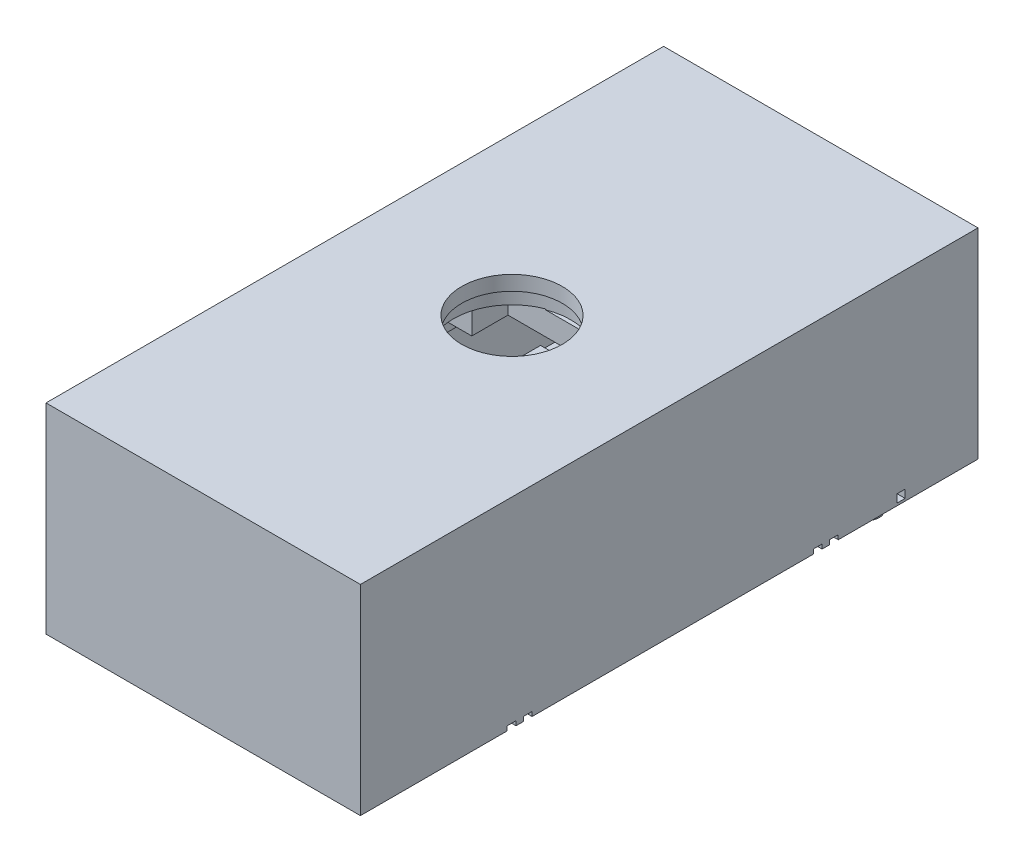
from build123d import *

# Parameters (mm, degrees)
BLOCK_START                       = 4.7
SKETCH1_W                         = 39.1
SKETCH1_H                         = 76.8
BLOCK_DEPTH                       = 24.90232
CELL_START                        = 7.14
SKETCH2_W                         = 34.9
SKETCH2_H                         = 53.5
CELL_POCKET_DEPTH                 = 11.86
CELL_START_2                      = 6.6
SKETCH3_W                         = 34.9
SKETCH3_H                         = 10.6
CELL_PROTECTION_BOARD_END_DEPTH   = 0.54
S1_S3_START                       = 4.7
SKETCH4_W                         = 9.25
SKETCH4_H                         = 6.5
SKETCH4_W_2                       = 9.05
S1_S3_AND_PLUG_POCKETS_DEPTH      = 1.9
J4_START                          = 4.7
SKETCH5_W                         = 17.5
SKETCH5_H                         = 10.7
J4_AND_FLEX_ENTRY_DEPTH           = 1.9
SKETCH6_W                         = 17.5
SKETCH6_H                         = 4.8
J4_FLEX_RISER_DEPTH               = 20.19
FLEX_START                        = 19
SKETCH7_W                         = 17.5
SKETCH7_H                         = 20.9
FLEX_CHANNEL_OVER_THE_CELLS_DEPTH = 5.89
CAMERA_START                      = 19
SKETCH8_W                         = 25.6
SKETCH8_H                         = 24.5
CAMERA_BOARD_POCKET_DEPTH         = 3.58232
HOLDER_START                      = 22.48232
SKETCH9_W                         = 14.6
SKETCH9_H                         = 13.6
HOLDER_POCKET_DEPTH               = 3.1
SKETCH10_W                        = 22.6
SKETCH10_H                        = 4.6
HOLDER_EAR_POCKET_DEPTH           = 3.1
CAMERA_START_2                    = 22.48232
SKETCH11_W                        = 18.2
SKETCH11_H                        = 5.8
CAMERA_FFC_POCKET_DEPTH           = 2.40768
BARREL_START                      = 25.48232
SKETCH12_R                        = 7.3
BARREL_HOLE_DEPTH                 = 2.3
LENS_START                        = 27.68232
SKETCH13_R                        = 6.25
LENS_THREAD_HOLE_DEPTH            = 26.409580036
SKETCH14_R                        = 0.8
CAMERA_SCREW_PILOTS_DEPTH         = 4.6
PROBE_START                       = 4.7
SKETCH15_W                        = 1.6
SKETCH15_H                        = 1.1
PROBE_WIRE_HALF_SLOTS_DEPTH       = 0.55
MIC_START                         = 4.7
SKETCH16_R                        = 1.5
MIC_TUBE_DEPTH                    = 2.9
MIC_START_2                       = 1.7
SKETCH17_R                        = 0.5
MIC_BORE_DEPTH                    = 4.3
MIC_START_3                       = 5
SKETCH18_W                        = 4.93
SKETCH18_H                        = 1
MIC_DUCT_DEPTH                    = 1


with BuildPart() as part:
    # Sketch1 → Block (new body)
    with BuildSketch(Plane(origin=(0, 0, 0), x_dir=(1, 0, 0), z_dir=(0, 1, 0)).offset(BLOCK_START)):
        with Locations((0, 1.1)):
            Rectangle(SKETCH1_W, SKETCH1_H)
    extrude(amount=BLOCK_DEPTH)

    # Sketch2 → Cell pocket (cut)
    with BuildSketch(Plane(origin=(0, 0, 0), x_dir=(1, 0, 0), z_dir=(0, 1, 0)).offset(CELL_START)):
        with Locations((0, 5.95)):
            Rectangle(SKETCH2_W, SKETCH2_H)
    extrude(amount=CELL_POCKET_DEPTH, mode=Mode.SUBTRACT)

    # Sketch3 → Cell protection-board end (cut)
    with BuildSketch(Plane(origin=(0, 0, 0), x_dir=(1, 0, 0), z_dir=(0, 1, 0)).offset(CELL_START_2)):
        with Locations((0, 27.4)):
            Rectangle(SKETCH3_W, SKETCH3_H)
    extrude(amount=CELL_PROTECTION_BOARD_END_DEPTH, mode=Mode.SUBTRACT)

    # Sketch4 → S1-S3 and plug pockets (cut)
    with BuildSketch(Plane(origin=(0, 0, 0), x_dir=(1, 0, 0), z_dir=(0, 1, 0)).offset(S1_S3_START)):
        with Locations((-13.825, 1.5)):
            Rectangle(SKETCH4_W, SKETCH4_H)
        with Locations((13.925, 20.57)):
            Rectangle(SKETCH4_W_2, SKETCH4_H)
        with Locations((13.825, -17.5)):
            Rectangle(SKETCH4_W, SKETCH4_H)
    extrude(amount=S1_S3_AND_PLUG_POCKETS_DEPTH, mode=Mode.SUBTRACT)

    # Sketch5 → J4 and flex entry (cut)
    with BuildSketch(Plane(origin=(0, 0, 0), x_dir=(1, 0, 0), z_dir=(0, 1, 0)).offset(J4_START)):
        with Locations((-0.35, 32.15)):
            Rectangle(SKETCH5_W, SKETCH5_H)
    extrude(amount=J4_AND_FLEX_ENTRY_DEPTH, mode=Mode.SUBTRACT)

    # Sketch6 → J4 flex riser (cut)
    with BuildSketch(Plane(origin=(0, 0, 0), x_dir=(1, 0, 0), z_dir=(0, 1, 0)).offset(J4_START)):
        with Locations((-0.35, 35.1)):
            Rectangle(SKETCH6_W, SKETCH6_H)
    extrude(amount=J4_FLEX_RISER_DEPTH, mode=Mode.SUBTRACT)

    # Sketch7 → Flex channel over the cells (cut)
    with BuildSketch(Plane(origin=(0, 0, 0), x_dir=(1, 0, 0), z_dir=(0, 1, 0)).offset(FLEX_START)):
        with Locations((-0.35, 27.05)):
            Rectangle(SKETCH7_W, SKETCH7_H)
    extrude(amount=FLEX_CHANNEL_OVER_THE_CELLS_DEPTH, mode=Mode.SUBTRACT)

    # Sketch8 → Camera board pocket (cut)
    with BuildSketch(Plane(origin=(0, 0, 0), x_dir=(1, 0, 0), z_dir=(0, 1, 0)).offset(CAMERA_START)):
        with Locations((0, 4.95)):
            Rectangle(SKETCH8_W, SKETCH8_H)
    extrude(amount=CAMERA_BOARD_POCKET_DEPTH, mode=Mode.SUBTRACT)

    # Sketch9 → Holder pocket (cut)
    with BuildSketch(Plane(origin=(0, 0, 0), x_dir=(1, 0, 0), z_dir=(0, 1, 0)).offset(HOLDER_START)):
        with Locations((0, 1.1)):
            Rectangle(SKETCH9_W, SKETCH9_H)
    extrude(amount=HOLDER_POCKET_DEPTH, mode=Mode.SUBTRACT)

    # Sketch10 → Holder ear pocket (cut)
    with BuildSketch(Plane(origin=(0, 0, 0), x_dir=(1, 0, 0), z_dir=(0, 1, 0)).offset(HOLDER_START)):
        with Locations((0, 1.1)):
            Rectangle(SKETCH10_W, SKETCH10_H)
    extrude(amount=HOLDER_EAR_POCKET_DEPTH, mode=Mode.SUBTRACT)

    # Sketch11 → Camera FFC pocket (cut)
    with BuildSketch(Plane(origin=(0, 0, 0), x_dir=(1, 0, 0), z_dir=(0, 1, 0)).offset(CAMERA_START_2)):
        with Locations((0, 15)):
            Rectangle(SKETCH11_W, SKETCH11_H)
    extrude(amount=CAMERA_FFC_POCKET_DEPTH, mode=Mode.SUBTRACT)

    # Sketch12 → Barrel hole (cut)
    with BuildSketch(Plane(origin=(0, 0, 0), x_dir=(1, 0, 0), z_dir=(0, 1, 0)).offset(BARREL_START)):
        with Locations((0, 1.1)):
            Circle(SKETCH12_R)
    extrude(amount=BARREL_HOLE_DEPTH, mode=Mode.SUBTRACT)

    # Sketch13 → Lens thread hole (cut, through all)
    with BuildSketch(Plane(origin=(0, 0, 0), x_dir=(1, 0, 0), z_dir=(0, 1, 0)).offset(LENS_START)):
        with Locations((0, 1.1)):
            Circle(SKETCH13_R)
    extrude(amount=LENS_THREAD_HOLE_DEPTH, mode=Mode.SUBTRACT)

    # Sketch14 → Camera screw pilots (cut)
    with BuildSketch(Plane(origin=(0, 0, 0), x_dir=(1, 0, 0), z_dir=(0, 1, 0)).offset(CAMERA_START_2)):
        with Locations((10.5, 7.52)):
            Circle(SKETCH14_R)
        with Locations((-10.5, 7.52)):
            Circle(SKETCH14_R)
        with Locations((10.5, -4.98)):
            Circle(SKETCH14_R)
        with Locations((-10.5, -4.98)):
            Circle(SKETCH14_R)
    extrude(amount=CAMERA_SCREW_PILOTS_DEPTH, mode=Mode.SUBTRACT)

    # Sketch15 → Probe wire half-slots (cut)
    with BuildSketch(Plane(origin=(0, 0, 0), x_dir=(1, 0, 0), z_dir=(0, 1, 0)).offset(PROBE_START)):
        with Locations((-18.95, 2.5)):
            Rectangle(SKETCH15_W, SKETCH15_H)
        with Locations((-18.95, 0.5)):
            Rectangle(SKETCH15_W, SKETCH15_H)
        with Locations((18.95, 21.57)):
            Rectangle(SKETCH15_W, SKETCH15_H)
        with Locations((18.95, 19.57)):
            Rectangle(SKETCH15_W, SKETCH15_H)
        with Locations((18.95, -16.5)):
            Rectangle(SKETCH15_W, SKETCH15_H)
        with Locations((18.95, -18.5)):
            Rectangle(SKETCH15_W, SKETCH15_H)
    extrude(amount=PROBE_WIRE_HALF_SLOTS_DEPTH, mode=Mode.SUBTRACT)

    # Sketch16 → Mic tube (add)
    with BuildSketch(Plane(origin=(0, 0, 0), x_dir=(1, 0, 0), z_dir=(0, 1, 0)).offset(MIC_START)):
        with Locations((15.32, 29.94)):
            Circle(SKETCH16_R)
    extrude(amount=-MIC_TUBE_DEPTH)

    # Sketch17 → Mic bore (cut)
    with BuildSketch(Plane(origin=(0, 0, 0), x_dir=(1, 0, 0), z_dir=(0, 1, 0)).offset(MIC_START_2)):
        with Locations((15.32, 29.94)):
            Circle(SKETCH17_R)
    extrude(amount=MIC_BORE_DEPTH, mode=Mode.SUBTRACT)

    # Sketch18 → Mic duct (cut)
    with BuildSketch(Plane(origin=(0, 0, 0), x_dir=(1, 0, 0), z_dir=(0, 1, 0)).offset(MIC_START_3)):
        with Locations((17.285, 29.94)):
            Rectangle(SKETCH18_W, SKETCH18_H)
    extrude(amount=MIC_DUCT_DEPTH, mode=Mode.SUBTRACT)


solid = part.part
